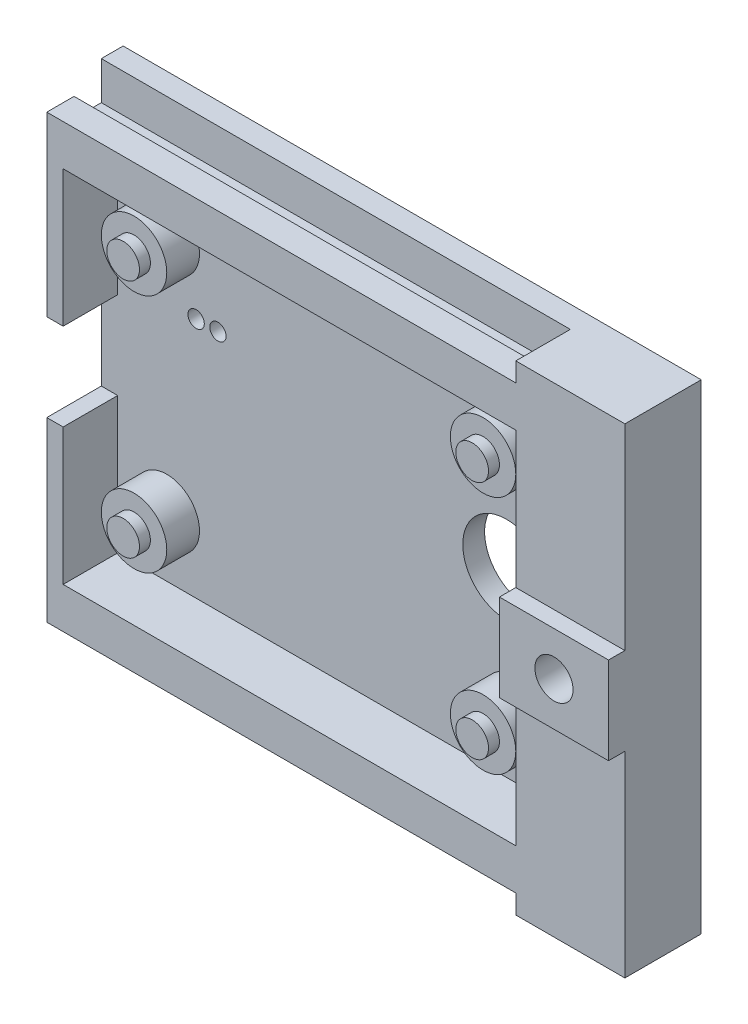
from build123d import *
from build123d.topology import SkipClean

# Parameters (mm, degrees)
CROQUIS1_W              = 53
CROQUIS1_H              = 44
CROQUIS1_R              = 0.75
CROQUIS1_R_2            = 4
SALIENTE_EXTRUIR1_DEPTH = 2
CROQUIS4_R              = 1.5
SALIENTE_EXTRUIR3_DEPTH = 4
CORTAR_EXTRUIR1_REACH   = 40.484
CROQUIS5_R              = 1.75
CROQUIS6_R              = 1.75
CROQUIS6_W              = 41.5
CROQUIS6_H              = 33
SALIENTE_EXTRUIR4_DEPTH = 5
CROQUIS7_W              = 43
CROQUIS7_H              = 1.75
SALIENTE_EXTRUIR5_DEPTH = 2.5
CROQUIS8_W              = 1.5
CROQUIS8_H              = 8
CORTAR_EXTRUIR3_DEPTH   = 5
CROQUIS9_R              = 3.5
CORTAR_EXTRUIR4_DEPTH   = 5
CROQUIS10_R             = 3
SALIENTE_EXTRUIR6_DEPTH = 3
CROQUIS12_W             = 10
CROQUIS12_H             = 8
CROQUIS12_R             = 1.75
SALIENTE_EXTRUIR7_DEPTH = 1.5


with BuildPart() as part:
    # Croquis1 → Saliente-Extruir1 (new body)
    with BuildSketch(Plane.XY):
        with Locations((4.5, 0)):
            Rectangle(CROQUIS1_W, CROQUIS1_H)
        with Locations((-13.3084, 5.6686)):
            Circle(CROQUIS1_R, mode=Mode.SUBTRACT)
        with Locations((-11.3084, 5.6686)):
            Circle(CROQUIS1_R, mode=Mode.SUBTRACT)
        with Locations((15.1396, 0)):
            Circle(CROQUIS1_R_2, mode=Mode.SUBTRACT)
    extrude(amount=SALIENTE_EXTRUIR1_DEPTH)

    # Croquis4 → Saliente-Extruir3 (add)
    with BuildSketch(Plane.XY.offset(2)):
        with Locations((-16, -11)):
            Circle(CROQUIS4_R)
        with Locations((16, -11)):
            Circle(CROQUIS4_R)
        with Locations((16, 11)):
            Circle(CROQUIS4_R)
        with Locations((-16, 11)):
            Circle(CROQUIS4_R)
    extrude(amount=SALIENTE_EXTRUIR3_DEPTH)

    # Croquis5 → Cortar-Extruir1 (cut, up to next)
    with BuildSketch(Plane(origin=(0, 0, 0), x_dir=(-1, 0, 0), z_dir=(0, 0, -1)), mode=Mode.PRIVATE) as cortar_extruir1_sk1:
        with Locations((-26, 0)):
            Circle(CROQUIS5_R)
    cortar_extruir1_tool1 = extrude(cortar_extruir1_sk1.sketch, amount=-CORTAR_EXTRUIR1_REACH, mode=Mode.PRIVATE) & part.part
    add(cortar_extruir1_tool1.solids().sort_by_distance((26, 0, 0))[0], mode=Mode.SUBTRACT)

    # Croquis6 → Saliente-Extruir4 (add)
    with SkipClean():  # the faces are left unmerged after this step: merging them gives an invalid solid
        with BuildSketch(Plane.XY.offset(2)):
            Polygon((-22, -18.5), (21, -18.5), (21, -22), (31, -22), (31, 22), (21, 22), (21, 18.5), (-22, 18.5), align=None)
            with Locations((26, 0)):
                Circle(CROQUIS6_R, mode=Mode.SUBTRACT)
            with Locations((0.25, 0)):
                Rectangle(CROQUIS6_W, CROQUIS6_H, mode=Mode.SUBTRACT)
        extrude(amount=SALIENTE_EXTRUIR4_DEPTH)

    # Croquis7 → Saliente-Extruir5 (add)
    with SkipClean():  # the faces are left unmerged after this step: merging them gives an invalid solid
        with BuildSketch(Plane.XY.offset(7)):
            with Locations((-0.5, 19.375)):
                Rectangle(CROQUIS7_W, CROQUIS7_H)
            with Locations((-0.5, -19.375)):
                Rectangle(CROQUIS7_W, CROQUIS7_H)
        extrude(amount=-SALIENTE_EXTRUIR5_DEPTH)

    # Croquis8 → Cortar-Extruir3 (cut)
    with SkipClean():  # the faces are left unmerged after this step: merging them gives an invalid solid
        with BuildSketch(Plane.XY.offset(7)):
            with Locations((-21.25, 0)):
                Rectangle(CROQUIS8_W, CROQUIS8_H)
        extrude(amount=-CORTAR_EXTRUIR3_DEPTH, mode=Mode.SUBTRACT)

    # Croquis9 → Cortar-Extruir4 (cut)
    with BuildSketch(Plane(origin=(0, 0, 0), x_dir=(-1, 0, 0), z_dir=(0, 0, -1))):
        with Locations((-26, 0)):
            Circle(CROQUIS9_R)
    extrude(amount=-CORTAR_EXTRUIR4_DEPTH, mode=Mode.SUBTRACT)

    # Croquis10 → Saliente-Extruir6 (add)
    with BuildSketch(Plane.XY.offset(2)):
        with Locations((-16, 11)):
            Circle(CROQUIS10_R)
        with Locations((16, 11)):
            Circle(CROQUIS10_R)
        with Locations((16, -11)):
            Circle(CROQUIS10_R)
        with Locations((-16, -11)):
            Circle(CROQUIS10_R)
    extrude(amount=SALIENTE_EXTRUIR6_DEPTH)

    # Croquis12 → Saliente-Extruir7 (add)
    with BuildSketch(Plane.XY.offset(7)):
        with Locations((26, 0)):
            Rectangle(CROQUIS12_W, CROQUIS12_H)
        with Locations((26, 0)):
            Circle(CROQUIS12_R, mode=Mode.SUBTRACT)
    extrude(amount=SALIENTE_EXTRUIR7_DEPTH)


solid = part.part
